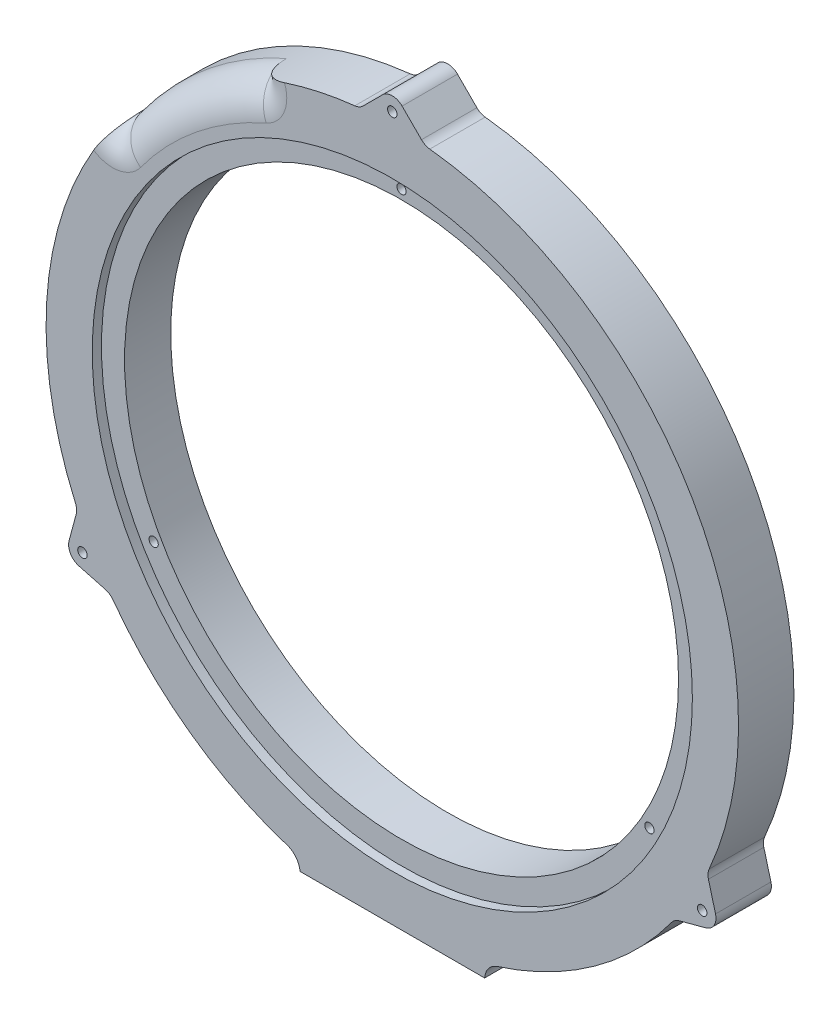
from build123d import *

# Parameters (mm, degrees)
SKETCH1_R                 = 150.00000000000003
SKETCH1_R_2               = 120
BOSS_EXTRUDE1_DEPTH       = 20
SKETCH2_R                 = 2.0000000000000018
CUT_EXTRUDE1_DEPTH        = 3.5
CIRPATTERN1_COUNT         = 3
SKETCH8_R                 = 150.00000000000006
SKETCH8_R_2               = 130
BOSS_EXTRUDE2_DEPTH       = 4
SPLIT1_SURFACE_1_BACK     = 425.942
SPLIT1_SURFACE_1_DEPTH    = 851.884
SPLIT1_SURFACE_2_BACK     = 425.942
SPLIT1_SURFACE_2_DEPTH    = 851.884
FILLET1_R                 = 15
SKETCH9_R                 = 2.049999999999871
BOSS_EXTRUDE3_DEPTH       = 24
FILLET2_R                 = 6
CIRPATTERN2_COUNT         = 3
FILLET2_OF_CIRPATTERN2_R  = 6
BOSS_EXTRUDE6_REACH       = 348.117
BOSS_EXTRUDE6_END_RADIUS  = 150.00000000000003
FILLET5_R                 = 8
M6X1_0_TAPPED_HOLE1_D     = 5
M6X1_0_TAPPED_HOLE1_DEPTH = 15
M6X1_0_TAPPED_HOLE1_TIP   = 1.5021515475689007


with BuildPart() as part:
    # Sketch1 → Boss-Extrude1 (new body)
    with BuildSketch(Plane.XY):
        Circle(SKETCH1_R)
        Circle(SKETCH1_R_2, mode=Mode.SUBTRACT)
    extrude(amount=BOSS_EXTRUDE1_DEPTH)

    # Sketch2 → Cut-Extrude1 (cut)
    with BuildSketch(Plane.XY.offset(20)):
        with Locations((0, 124)):
            Circle(SKETCH2_R)
    cut_extrude1 = extrude(amount=-CUT_EXTRUDE1_DEPTH, mode=Mode.SUBTRACT)

    # CirPattern1: Cut-Extrude1 ×3 about axis
    cirpattern1_axis = Axis((-4.94e-15, -7.48e-15, 0), (0, 0, 1))
    for i in range(1, CIRPATTERN1_COUNT):
        add(cut_extrude1.rotate(cirpattern1_axis, i * 360 / CIRPATTERN1_COUNT), mode=Mode.SUBTRACT)

    # Sketch8 → Boss-Extrude2 (add)
    with BuildSketch(Plane.XY.offset(20)):
        Circle(SKETCH8_R)
        Circle(SKETCH8_R_2, mode=Mode.SUBTRACT)
    extrude(amount=BOSS_EXTRUDE2_DEPTH)


with BuildPart() as body_2:
    # Split1: the piece behind the surface
    add(part.part)
    # Split1 surface: a surface, the sketch's curves swept straight by 851.884 mm
    with BuildLine(Plane.XY.offset(20).offset(-SPLIT1_SURFACE_1_BACK), mode=Mode.PRIVATE) as split1_surface_1_path:
        Line((-60.71743008822855, 137.16192505021607), (0, 0))
        Line((0, 0), (-121.16379943401968, 88.42699648134986))
    split1_surface_1 = Shell.extrude(split1_surface_1_path.wire(), (0 * SPLIT1_SURFACE_1_DEPTH, 0 * SPLIT1_SURFACE_1_DEPTH, 1 * SPLIT1_SURFACE_1_DEPTH))
    split(bisect_by=split1_surface_1, keep=Keep.BOTTOM)

    # Fillet1
    fillet1_edges = [body_2.edges().sort_by_distance(p)[0] for p in [
        (-94.14865229404315, 116.77341851301341, 24),
    ]]
    fillet(fillet1_edges, radius=FILLET1_R)


with BuildPart() as part_1:
    add(part.part)

    # Split1: split by a surface, the side it looks to stays
    # Split1 surface: a surface, the sketch's curves swept straight by 851.884 mm
    with BuildLine(Plane.XY.offset(20).offset(-SPLIT1_SURFACE_2_BACK), mode=Mode.PRIVATE) as split1_surface_2_path:
        Line((-60.71743008822855, 137.16192505021607), (0, 0))
        Line((0, 0), (-121.16379943401968, 88.42699648134986))
    split1_surface_2 = Shell.extrude(split1_surface_2_path.wire(), (0 * SPLIT1_SURFACE_2_DEPTH, 0 * SPLIT1_SURFACE_2_DEPTH, 1 * SPLIT1_SURFACE_2_DEPTH))
    split(bisect_by=split1_surface_2, keep=Keep.TOP)

    # Sketch6 → Cut-Revolve2 (revolve, cut)
    with BuildSketch(Plane(origin=(0, 0, 0), x_dir=(0, 0, 1), z_dir=(-0.914412833668107, -0.40478286725485696, 0))):
        with BuildLine():
            Line((24, 135.00000000000006), (24, 150.00000000000006))
            Line((24, 150.00000000000006), (9, 150.00000000000006))
            ThreePointArc((9.000000000000004, 150.00000000000006), (19.606601717798213, 145.60660171779824), (23.999999999999993, 135.00000000000003))
        make_face()
    cut_revolve2 = revolve(axis=Axis((-60.71743008822857, 137.1619250502161, 24), (0, 0, -1)), mode=Mode.SUBTRACT)

    # Mirror1: Cut-Revolve2 across plane
    add(cut_revolve2.mirror(Plane(origin=(0, 0, 0), x_dir=(0, 0, 1), z_dir=(-0.7784894567534315, -0.6276576819602762, 0))), mode=Mode.SUBTRACT)


with BuildPart() as body_2_1:
    add(body_2.part)

    # Combine1: union part
    add(part_1.part)

    # Sketch9 → Boss-Extrude3 (add)
    # profile 1 of 3: a face of its own
    with BuildSketch(Plane.XY.offset(24)):
        with BuildLine():
            ThreePointArc((-3.262499377045517, 149.96451612903218), (-5.966798192877617, 154.36966728986033), (-4.24264068711927, 159.2426406871193))
            Line((-4.242640687119266, 159.2426406871193), (-14.15461886744679, 149.33066250679175))
            ThreePointArc((-14.1546188674468, 149.33066250679167), (-8.714324103983273, 149.7466545716823), (-3.2624993770454083, 149.9645161290323))
        make_face()
    # profile 2 of 3: a face of its own
    with BuildSketch(Plane.XY.offset(24)):
        with BuildLine():
            Line((14.154618867446969, 149.3306625067917), (4.242640687119273, 159.24264068711932))
            ThreePointArc((4.242640687119273, 159.24264068711932), (5.543277195067717, 157.29610059419056), (6, 155.00000000000003))
            ThreePointArc((6, 155.00000000000003), (5.27138483997677, 152.13425369774941), (3.262499377045641, 149.96451612903223))
            ThreePointArc((3.262499377045714, 149.96451612903223), (8.714324103983444, 149.7466545716823), (14.154618867446963, 149.33066250679167))
        make_face()
    # profile 3 of 3: a face of its own
    with BuildSketch(Plane.XY.offset(24)):
        with BuildLine():
            ThreePointArc((4.242640687119273, 159.24264068711932), (-3.07e-15, 161), (-4.242640687119268, 159.2426406871193))
            ThreePointArc((-4.24264068711927, 159.2426406871193), (-5.966798192877617, 154.36966728986033), (-3.262499377045517, 149.96451612903218))
            ThreePointArc((-3.2624993770454083, 149.9645161290323), (1.4921e-13, 150), (3.262499377045714, 149.96451612903223))
            ThreePointArc((3.262499377045641, 149.96451612903223), (5.27138483997677, 152.13425369774941), (6, 155.00000000000003))
            ThreePointArc((6, 155.00000000000003), (5.543277195067717, 157.29610059419056), (4.242640687119273, 159.24264068711932))
        make_face()
        with Locations((1.388e-14, 155.00000000000003)):
            Circle(SKETCH9_R, mode=Mode.SUBTRACT)
    boss_extrude3 = extrude(amount=-BOSS_EXTRUDE3_DEPTH)

    # Fillet2
    fillet2_edges = [body_2_1.edges().sort_by_distance(p)[0] for p in [
        (-14.154618867446795, 149.33066250679173, 12),
        (14.154618867446967, 149.33066250679167, 12),
    ]]
    fillet(fillet2_edges, radius=FILLET2_R)

    # CirPattern2: Boss-Extrude3 ×3 about axis
    cirpattern2_axis = Axis((1.08e-15, -6.48e-15, 0), (0, 0, 1))
    for i in range(1, CIRPATTERN2_COUNT):
        add(boss_extrude3.rotate(cirpattern2_axis, i * 360 / CIRPATTERN2_COUNT))

    # Fillet2 of CirPattern2
    fillet2_of_cirpattern2_edges = [body_2_1.edges().sort_by_distance(p)[0] for p in [
        (-122.24683786111865, -86.9235907734913, 12),
        (-136.40145672856548, -62.40707173330022, 12),
        (136.4014567285654, -62.407071733300505, 12),
        (122.24683786111846, -86.92359077349151, 12),
    ]]
    fillet(fillet2_of_cirpattern2_edges, radius=FILLET2_OF_CIRPATTERN2_R)

    # Boss-Extrude6: up to this cylinder (the profile starts outside it)
    boss_extrude6_end = Plane(origin=(0, 0, 12), z_dir=(0, 0, -1)) * Cylinder(BOSS_EXTRUDE6_END_RADIUS, 997.2340000000002, mode=Mode.PRIVATE)
    # Sketch12 → Boss-Extrude6 (add, up to the surface)
    with BuildSketch(Plane(origin=(0, -150.00000000000003, 0), x_dir=(-1, 0, 0), z_dir=(0, -1, 0)), mode=Mode.PRIVATE) as boss_extrude6_sk1:
        Polygon((0, 0), (-40, -4.9e-15), (-40.00000000000001, -24), (0, -24), align=None)
    boss_extrude6_tool1 = extrude(boss_extrude6_sk1.sketch, amount=-BOSS_EXTRUDE6_REACH, mode=Mode.PRIVATE) - boss_extrude6_end
    add(boss_extrude6_tool1.solids().sort_by_distance((20, -150, 12))[0])
    # Sketch12 → Boss-Extrude6 (add, up to the surface)
    with BuildSketch(Plane(origin=(0, -150.00000000000003, 0), x_dir=(-1, 0, 0), z_dir=(0, -1, 0)), mode=Mode.PRIVATE) as boss_extrude6_sk2:
        Polygon((40, 0), (40.00000000000001, -24), (0, -24), (0, 0), align=None)
    boss_extrude6_tool2 = extrude(boss_extrude6_sk2.sketch, amount=-BOSS_EXTRUDE6_REACH, mode=Mode.PRIVATE) - boss_extrude6_end
    add(boss_extrude6_tool2.solids().sort_by_distance((-20, -150, 12))[0])

    # Fillet5
    # the kernel refuses this fillet: 8 mm, written as the material it adds along each edge
    with BuildSketch(Plane(origin=(40.00000000000015, -144.56832294800958, 24), x_dir=(0.9584597244138898, 0.2852279030467574, 0), z_dir=(0, 0, -1))) as fillet5_piece_1:
        with BuildLine():
            CenterArc((5.947542883110703, 7.998508324991874), FILLET5_R, 200.42971386414416, 68.4638241646868)
            Line((-1.5492658555665646, 5.2060436903559735), (-1.699202030340109, 5.1501943976632605))
            ThreePointArc((-1.699202030340109, 5.1501943976632605), (-0.9279864836895695, 2.5573853806904863), (-0.1533535559062191, -0.04563646448748021))
            Line((-0.1533535559062191, -0.04563646448748021), (0.00308963266655187, -0.15997016649984888))
            ThreePointArc((0.00308963266655187, -0.15997016649984888), (2.8965306248915494, -0.1320310935977963), (5.7899716171165965, -0.15997016649985063))
            Line((5.7899716171165965, -0.15997016649985063), (5.793061249783145, 1.4e-16))
        make_face()
    extrude(amount=24)
    with BuildSketch(Plane(origin=(-40.00000000000015, -144.56832294800958, 24), x_dir=(1.57e-14, -1, 0), z_dir=(0, 0, -1))) as fillet5_piece_2:
        with BuildLine():
            CenterArc((5.969842900063457, 7.98187806972569), FILLET5_R, 197.67893389575954, 68.46382416468674)
            Line((-1.652342712497161, 5.552415888979961), (-1.804786424748387, 5.503826645365045))
            ThreePointArc((-1.804786424748387, 5.503826645365045), (-0.9527178418323817, 2.738548992526119), (-0.1542062111445539, -0.04266666666667149))
            Line((-0.1542062111445539, -0.04266666666667149), (2.51e-15, -0.1599999999999966))
            ThreePointArc((2.51e-15, -0.1599999999999966), (2.7158385259952267, -0.16000000000009607), (5.420913735028992, -0.15963756139451152))
            Line((5.420913735028992, -0.15963756139451152), (5.431677051990448, 0))
        make_face()
    extrude(amount=24)

    # M6x1.0 Tapped Hole1
    with Locations(Plane(origin=(0, -150.00000000000003, 0), x_dir=(-1, 0, 0), z_dir=(0, -1, 0))):
        with Locations((-25, -12), (25, -12)):
            Hole(M6X1_0_TAPPED_HOLE1_D / 2, depth=M6X1_0_TAPPED_HOLE1_DEPTH)
            with Locations((0, 0, -(M6X1_0_TAPPED_HOLE1_DEPTH + M6X1_0_TAPPED_HOLE1_TIP / 2))):  # 118° drill point
                Cone(0, M6X1_0_TAPPED_HOLE1_D / 2, M6X1_0_TAPPED_HOLE1_TIP, mode=Mode.SUBTRACT)


solid = body_2_1.part
